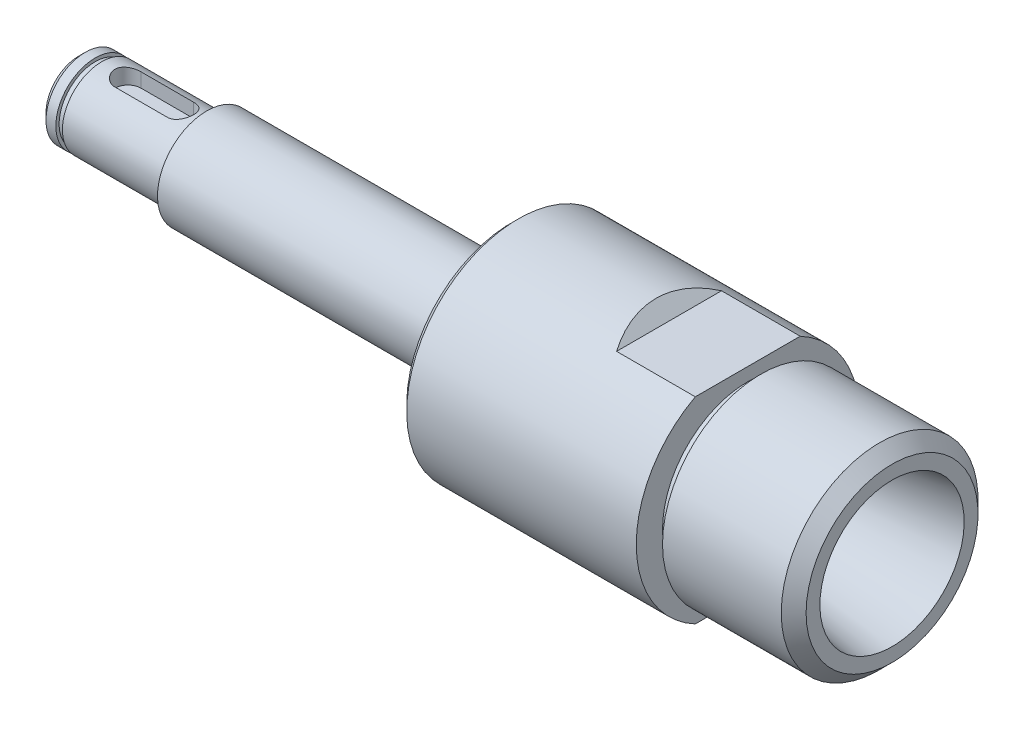
from build123d import *

# Parameters (mm, degrees)
CHAMFER_1_SIZE              = 1
CUT_EXTRUDE_START           = -22
SKETCH_2_OUTSIDE_W          = 62.6
SKETCH_2_OUTSIDE_H          = 62.6
SKETCH_2_OUTSIDE_R          = 13
CUT_EXTRUDE_1_DEPTH         = 2
CUT_EXTRUDE_START_2         = -14
CUT_EXTRUDE_2_DEPTH         = 14
CHAMFER_2_SIZE              = 2
CUT_EXTRUDE_START_3         = 3.5
CUT_EXTRUDE_3_DEPTH         = 123.809144562
HOLE_WIZARD_14_0_14_1_D     = 14
HOLE_WIZARD_14_0_14_1_DEPTH = 16
HOLE_WIZARD_14_0_14_1_TIP   = 4.206024333
CHAMFER_3_SIZE              = 1


# Read off the part's stored shape, not the designer's step: M30 机械螺纹 螺柱1, 切除-拉伸2
with BuildPart() as part:
    # 草图1 → 旋转1 (revolve)
    with BuildSketch(Plane.XY):
        Polygon((0, 0), (0, 6), (2.5, 6), (2.5, 5.5), (3.5, 5.5), (3.5, 6), (18.5, 6), (18.5, 5.5), (19.5, 5.5), (19.5, 7.5), (64, 7.5), (64, 6.5), (66, 6.5), (66, 17), (124, 17), (124, 0), align=None)
    revolve(axis=Axis((124, 0, 0), (-1, 0, 0)))

    # 倒角1
    chamfer_1_edges = [part.edges().sort_by_distance(p)[0] for p in [
        (66, -17, 0),
        (0, -6, 0),
    ]]
    chamfer(chamfer_1_edges, length=CHAMFER_1_SIZE)

    # 草图2 outside → 切除-拉伸1 (cut)
    with BuildSketch(Plane(origin=(124, 0, 0), x_dir=(0, 0, -1), z_dir=(1, 0, 0)).offset(CUT_EXTRUDE_START)):
        Rectangle(SKETCH_2_OUTSIDE_W, SKETCH_2_OUTSIDE_H)
        with Locations(Location((0, 0, 0), (0, 0, 90))):
            Circle(SKETCH_2_OUTSIDE_R, mode=Mode.SUBTRACT)
    extrude(amount=CUT_EXTRUDE_1_DEPTH, mode=Mode.SUBTRACT)

    # M30 机械螺纹 螺柱1 outline → M30 机械螺纹 螺柱1 (revolve, cut)
    with BuildSketch(Plane.YX):
        Polygon((17, 124), (13.1055, 124), (15, 122.1055), (15, 104), (17, 104), align=None)
    revolve(axis=Axis((0, 0, 0), (1, 0, 0)), mode=Mode.SUBTRACT)

    # 切除-拉伸2 outline → 切除-拉伸2 (cut)
    with BuildSketch(Plane(origin=(102, 0, 0), x_dir=(0, 0, -1), z_dir=(1, 0, 0)).offset(CUT_EXTRUDE_START_2)):
        with BuildLine():
            Line((-8, 15), (8, 15))
            ThreePointArc((8, 15), (0, 17), (-8, 15))
        make_face()
        with BuildLine():
            Line((8, -15), (-8, -15))
            ThreePointArc((-8, -15), (0, -17), (8, -15))
        make_face()
    extrude(amount=CUT_EXTRUDE_2_DEPTH, mode=Mode.SUBTRACT)

    # 倒角2
    chamfer_2_edges = [part.edges().sort_by_distance(p)[0] for p in [
        (88, -15, 0),
        (88, 15, 0),
    ]]
    chamfer(chamfer_2_edges, length=CHAMFER_2_SIZE - 0.0001)  # a hair under: the kernel refuses the full size

    # 草图5 → 切除-拉伸3 (cut, through all)
    with BuildSketch(Plane(origin=(0, 0, 0), x_dir=(1, 0, 0), z_dir=(0, 1, 0)).offset(CUT_EXTRUDE_START_3)):
        with BuildLine():
            Line((15.5, -2), (7.5, -2))
            ThreePointArc((7.5, -2), (5.5, 0), (7.5, 2))
            Line((7.5, 2), (15.5, 2))
            ThreePointArc((15.5, 2), (17.5, 0), (15.5, -2))
        make_face()
    extrude(amount=CUT_EXTRUDE_3_DEPTH, mode=Mode.SUBTRACT)

    # 草图6 → 切除-旋转1 (revolve, cut)
    with BuildSketch(Plane.XY):
        Polygon((92, 0), (92, 9.5), (97, 9.5), (97, 9), (103, 9), (103, 9.5), (108, 9.5), (108, 8.680110408), (124, 11), (124, 0), align=None)
    revolve(axis=Axis((124, 0, 0), (-1, 0, 0)), mode=Mode.SUBTRACT)

    # Ø14.0 (14) 直径孔1
    with Locations(Plane(origin=(92, 0, 0), x_dir=(0, 0, -1), z_dir=(1, 0, 0))):
        with Locations((0, 0)):
            Hole(HOLE_WIZARD_14_0_14_1_D / 2, depth=HOLE_WIZARD_14_0_14_1_DEPTH)
            with Locations((0, 0, -(HOLE_WIZARD_14_0_14_1_DEPTH + HOLE_WIZARD_14_0_14_1_TIP / 2))):  # 118° drill point
                Cone(0, HOLE_WIZARD_14_0_14_1_D / 2, HOLE_WIZARD_14_0_14_1_TIP, mode=Mode.SUBTRACT)

    # 倒角3
    chamfer_3_edges = [part.edges().sort_by_distance(p)[0] for p in [
        (92, 0, -7),
    ]]
    chamfer(chamfer_3_edges, length=CHAMFER_3_SIZE)


solid = part.part
